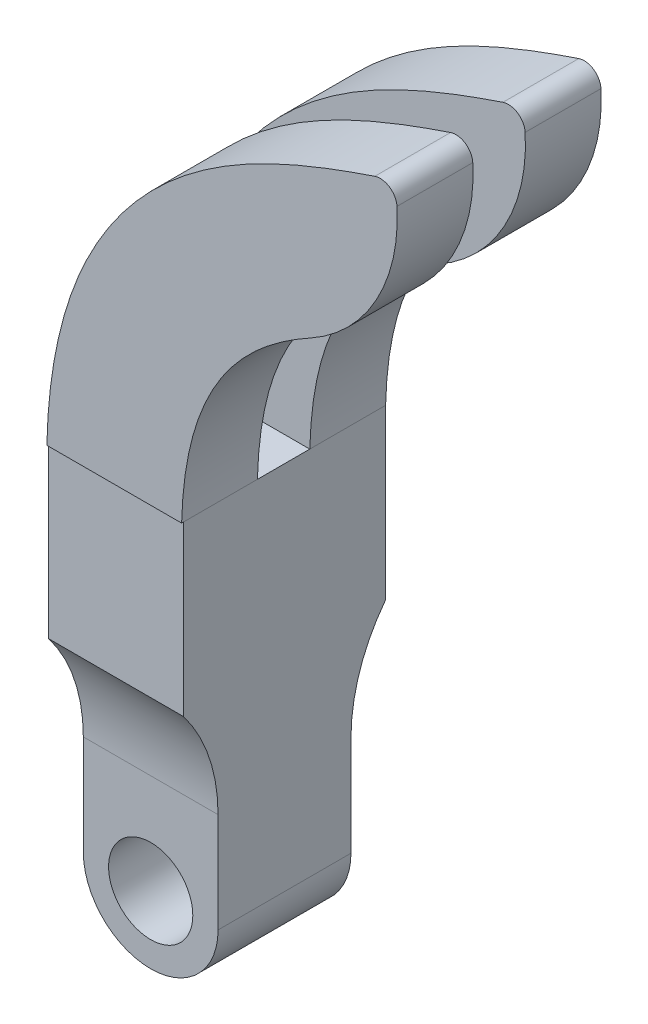
from build123d import *

# Parameters (mm, degrees)
ESBO_O3_R                = 2.5
RESSALTO_EXTRUS_O1_DEPTH = 7.89
ESBO_O4_W                = 8
ESBO_O4_H                = 12
RESSALTO_EXTRUS_O2_DEPTH = 10
FILETE1_R                = 10
VARREDURA1_START         = -2.055
VARREDURA1_DEPTH         = 4.5
FILETE2_R                = 10
FILETE3_R                = 1
FILETE2_OF_ESPELHAR1_R   = 10
FILETE3_OF_ESPELHAR1_R   = 1


# Read off the part's stored shape, not the designer's step: Varredura1
with BuildPart() as part:
    # Esboço3 → Ressalto-extrusão1 (new body)
    with BuildSketch(Plane.XY):
        with BuildLine():
            Line((-4, 0), (-4, 12))
            Line((-4, 12), (4, 12))
            Line((4, 12), (4, 0))
            ThreePointArc((4, 0), (0, -4), (-4, 0))
        make_face()
        Circle(ESBO_O3_R, mode=Mode.SUBTRACT)
    extrude(amount=RESSALTO_EXTRUS_O1_DEPTH)

    # Esboço4 → Ressalto-extrusão2 (add)
    with BuildSketch(Plane(origin=(0, 12, 0), x_dir=(1, 0, 0), z_dir=(0, 1, 0))):
        with Locations((0, -3.945)):
            Rectangle(ESBO_O4_W, ESBO_O4_H)
    extrude(amount=RESSALTO_EXTRUS_O2_DEPTH)

    # Filete1
    # the kernel refuses this fillet: 10 mm, written as the material it adds along each edge
    with BuildSketch(Plane(origin=(-4, 12, 0), x_dir=(0, 0, -1), z_dir=(1, 0, 0))) as filete1_piece_1:
        with BuildLine():
            CenterArc((10, -6.072641517), FILETE1_R, 142.608054869, 37.391945131)
            Line((0, -6.072641517), (-0.2, -6.072641517))
            Line((-0.2, -6.072641517), (-0.2, 0))
            Line((-0.2, 0), (0, 0.2))
            ThreePointArc((0, 0.2), (1.0275, 0.2), (1.8961, 0.12145283))
            Line((1.8961, 0.12145283), (2.055, 0))
        make_face()
    extrude(amount=8)
    with BuildSketch(Plane(origin=(-4, 12, 7.89), x_dir=(0, 0, 1), z_dir=(1, 0, 0))) as filete1_piece_2:
        with BuildLine():
            CenterArc((10, 6.072641517), FILETE1_R, 180, 37.391945131)
            Line((0, 6.072641517), (-0.2, 6.072641517))
            Line((-0.2, 6.072641517), (-0.2, 0))
            Line((-0.2, 0), (0, -0.2))
            ThreePointArc((0, -0.2), (1.0275, -0.2), (1.8961, -0.12145283))
            Line((1.8961, -0.12145283), (2.055, 0))
        make_face()
    extrude(amount=8)

    # Varredura1 outline → Varredura1 (add)
    with BuildSketch(Plane.XY.offset(VARREDURA1_START)):
        with BuildLine():
            Line((-4, 22), (4, 22))
            add(Edge.make_bspline(
                [(4, 22), (4.076004643, 24.789100523), (4.576744422, 27.046075873), (5.825537248, 29.832679333), (6.324748717, 30.661737223), (7.465829447, 32.153454516), (8.107698711, 32.816113914), (10.212438301, 34.604326425), (11.854440436, 35.53011384), (15.430236778, 37.114751087), (17.364030989, 37.773600914), (19.350774872, 38.4318674)],
                knots=[0, 0, 0, 0, 0.25, 0.25, 0.375, 0.375, 0.5, 0.5, 0.75, 0.75, 1, 1, 1, 1], degree=3))
            Line((19.350774872, 38.4318674), (16.628722538, 45.954528571))
            add(Edge.make_bspline(
                [(-4, 22), (-3.924365702, 25.610706729), (-3.278889097, 28.990240165), (-1.326924275, 33.467921051), (-0.516042652, 34.853906552), (1.338266133, 37.332612564), (2.378280036, 38.423434753), (5.639368368, 41.249638523), (7.969155498, 42.540719328), (12.436975606, 44.550100168), (14.600059443, 45.281114301), (16.628722538, 45.954528571)],
                knots=[0, 0, 0, 0, 0.25, 0.25, 0.375, 0.375, 0.5, 0.5, 0.75, 0.75, 1, 1, 1, 1], degree=3))
        make_face()
    varredura1 = extrude(amount=VARREDURA1_DEPTH)

    # Filete2
    # the kernel refuses this fillet: 10 mm, written as the material it takes off along each edge
    with BuildSketch(Plane(origin=(19.350774872, 38.4318674, -22.846513703), x_dir=(-0.9279643931477312, -0.3726688678303612, 8.125821655605385e-13), z_dir=(0, 2.1804401593599865e-12, 1.0))) as filete2_piece_1:
        with BuildLine():
            CenterArc((9.534418095, -9.925569628), FILETE2_R, 96.994915397, 71.874930906)
            Line((-0.277493979, -7.99518587), (-0.473732221, -7.956578195))
            ThreePointArc((-0.473732221, -7.956578195), (-0.338626636, -3.990655585), (-0.199879647, 0.006937349))
            Line((-0.199879647, 0.006937349), (0.012379593, 0.199616497))
            ThreePointArc((0.012379593, 0.199616497), (4.158510673, 0.013875219), (8.292249229, 0.198511393))
            Line((8.292249229, 0.198511393), (8.316605481, 0))
        make_face()
    extrude(amount=46.083027405, mode=Mode.SUBTRACT)

    # Filete3
    filete3_edges = [part.edges().sort_by_distance(p)[0] for p in [
        (16.628722538, 45.954528571, 0.195),
    ]]
    fillet(filete3_edges, radius=FILETE3_R)

    # Espelhar1: Varredura1 across plane
    add(varredura1.mirror(Plane.XY.offset(4)))

    # Filete2 of Espelhar1
    # the kernel refuses this fillet: 10 mm, written as the material it takes off along each edge
    with BuildSketch(Plane(origin=(19.350774872, 38.4318674, 30.846513703), x_dir=(-0.34025654174280723, 0.9403326463551213, 2.0503390652699583e-12), z_dir=(0, 2.1804401593599865e-12, -1.0))) as filete2_of_espelhar1_piece_1:
        with BuildLine():
            CenterArc((9.588878802, -9.87296633), FILETE2_OF_ESPELHAR1_R, 99.142350717, 71.874930906)
            Line((-0.288475994, -8.311600828), (-0.48602309, -8.280373518))
            ThreePointArc((-0.48602309, -8.280373518), (-0.158112079, -4.155526935), (-0.199925782, -0.005448096))
            Line((-0.199925782, -0.005448096), (0, 0.2))
            ThreePointArc((0, 0.2), (4, 0.2), (7.968222424, 0.197459327))
            Line((7.968222424, 0.197459327), (8, 0))
        make_face()
    extrude(amount=46.083027405, mode=Mode.SUBTRACT)

    # Filete3 of Espelhar1
    filete3_of_espelhar1_edges = [part.edges().sort_by_distance(p)[0] for p in [
        (16.628722538, 45.954528571, 7.805),
    ]]
    fillet(filete3_of_espelhar1_edges, radius=FILETE3_OF_ESPELHAR1_R)


solid = part.part
